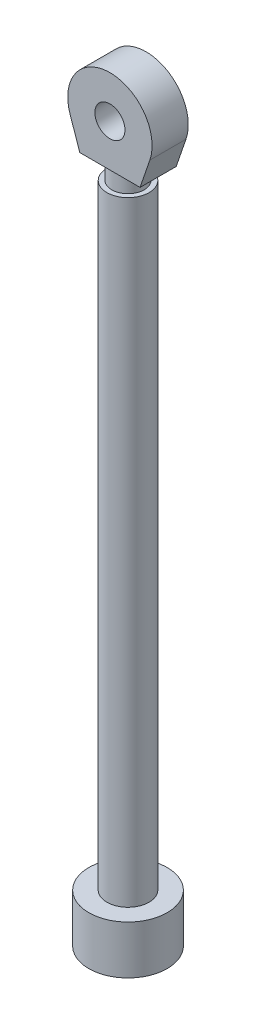
from build123d import *

# Parameters (mm, degrees)
SKETCH1_R           = 12.5
BOSS_EXTRUDE1_DEPTH = 15


with BuildPart() as part:
    # Sketch1 → Boss-Extrude1 (new, symmetric)
    with BuildSketch(Plane.XY):
        with BuildLine():
            Line((-25, -35), (25, -35))
            Line((25, -35), (33.108108108, -11.351351351))
            ThreePointArc((33.108108108, -11.351351351), (0, 35), (-33.108108108, -11.351351351))
            Line((-33.108108108, -11.351351351), (-25, -35))
        make_face()
        Circle(SKETCH1_R, mode=Mode.SUBTRACT)
    extrude(amount=BOSS_EXTRUDE1_DEPTH, both=True)

    # Sketch2 → Revolve-Thin1 (revolve)
    with BuildSketch(Plane.XY):
        Polygon((0, -35), (13.5, -35), (13.5, -50), (17.5, -50), (17.5, -560), (32.5, -560), (32.5, -600.222219569), (0, -600.222219569), (0, -590.222219569), (22.5, -590.222219569), (22.5, -570), (7.5, -570), (7.5, -60), (3.5, -60), (3.5, -45), (0, -45), align=None)
    revolve(axis=Axis((0, -560, 0), (0, 1, 0)))


solid = part.part
